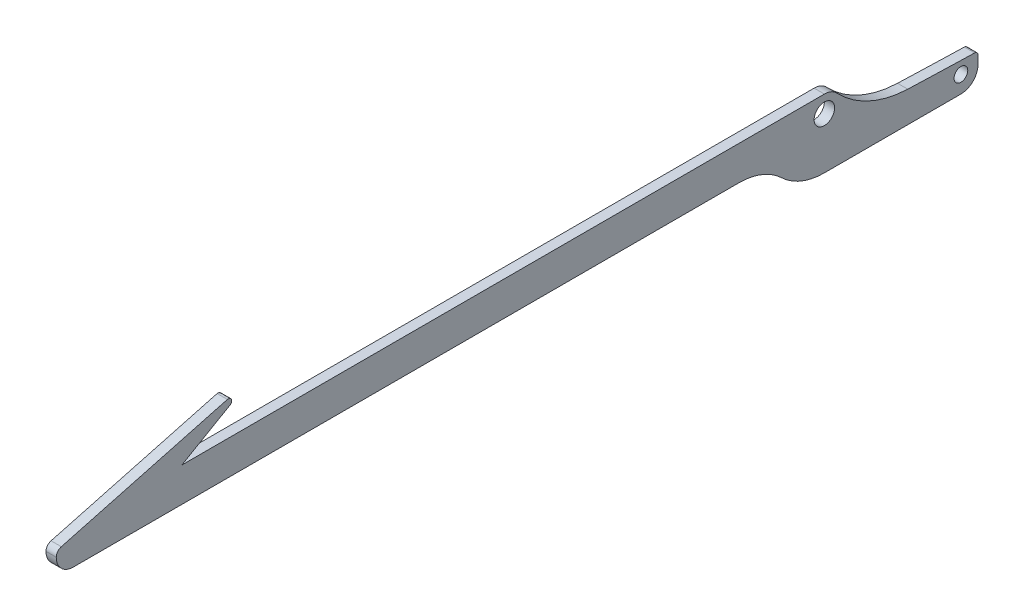
from build123d import *

# Parameters (mm, degrees)
EXTRUDE_1_DEPTH     = 1.5
EXTRUDE_2_DEPTH     = 3
CUT_EXTRUDE_1_DEPTH = 226.519400496
SKETCH_4_W          = 70
SKETCH_4_H          = 10
EXTRUDE_3_DEPTH     = 3
CUT_EXTRUDE_2_DEPTH = 226.519400496
FILLET_1_R          = 5
FILLET_START        = -1.5
FILLET_2_DEPTH      = 3
FILLET_3_R          = 1
CUT_EXTRUDE_3_DEPTH = 226.519400496
SKETCH_7_R          = 3
CUT_EXTRUDE_4_DEPTH = 226.519400496
SKETCH_8_R          = 2
CUT_EXTRUDE_5_DEPTH = 226.519400496


with BuildPart() as part:
    # ｽｹｯﾁ1 → ﾎﾞｽ - 押し出し1 (new, symmetric)
    with BuildSketch(Plane(origin=(0, 0, 0), x_dir=(0, 0, -1), z_dir=(1, 0, 0))):
        with BuildLine():
            Line((0, -5), (-220, -5))
            ThreePointArc((-220, -5), (-225, 0), (-220, 5))
            Line((-220, 5), (0, 5))
            ThreePointArc((0, 5), (5, 0), (0, -5))
        make_face()
    extrude(amount=EXTRUDE_1_DEPTH, both=True)

    # ｽｹｯﾁ2 → ﾎﾞｽ - 押し出し2 (add)
    with BuildSketch(Plane(origin=(1.5, 0, 0), x_dir=(0, 0, -1), z_dir=(1, 0, 0))):
        with BuildLine():
            Line((-223.51763809, 1.931851653), (-174.873811044, 14.965925826))
            ThreePointArc((-174.873811044, 14.965925826), (-173.691112467, 14.382683432), (-174.114991999, 13.133974596))
            Line((-174.114991999, 13.133974596), (-196.863703305, 0))
            Line((-196.863703305, 0), (-225, 0))
            ThreePointArc((-225, 0), (-224.586706681, 1.217522858), (-223.51763809, 1.931851653))
        make_face()
    extrude(amount=-EXTRUDE_2_DEPTH)

    # ｽｹｯﾁ3 → ｶｯﾄ - 押し出し1 (cut, through all)
    with BuildSketch(Plane(origin=(1.5, 0, 0), x_dir=(0, 0, -1), z_dir=(1, 0, 0))):
        with BuildLine():
            Line((-223.51763809, 1.931851653), (-212.067152572, 5))
            Line((-212.067152572, 5), (-220, 5))
            ThreePointArc((-220, 5), (-223.535533906, 3.535533906), (-225, 0))
            ThreePointArc((-225, 0), (-224.586706681, 1.217522858), (-223.51763809, 1.931851653))
        make_face()
    extrude(amount=-CUT_EXTRUDE_1_DEPTH, mode=Mode.SUBTRACT)

    # ｽｹｯﾁ4 → ﾎﾞｽ - 押し出し3 (add)
    with BuildSketch(Plane(origin=(1.5, 0, 0), x_dir=(0, 0, -1), z_dir=(1, 0, 0))):
        with Locations((10, -10)):
            Rectangle(SKETCH_4_W, SKETCH_4_H)
    extrude(amount=-EXTRUDE_3_DEPTH)

    # ｽｹｯﾁ5 → ｶｯﾄ - 押し出し2 (cut, through all)
    with BuildSketch(Plane(origin=(1.5, 0, 0), x_dir=(0, 0, -1), z_dir=(1, 0, 0))):
        with BuildLine():
            ThreePointArc((-0.222112537, -4.995064166), (22.385361516, -5.899367469), (45, -6.602057872))
            Line((45, -6.602057872), (45, -5))
            Line((45, -5), (0, -5))
            ThreePointArc((0, -5), (-0.111083686, -4.998765889), (-0.222112537, -4.995064166))
        make_face()
    extrude(amount=-CUT_EXTRUDE_2_DEPTH, mode=Mode.SUBTRACT)

    # ﾌｨﾚｯﾄ1
    fillet_1_edges = [part.edges().sort_by_distance(p)[0] for p in [
        (0, -15, -45),
    ]]
    fillet(fillet_1_edges, radius=FILLET_1_R)

    # ﾌｨﾚｯﾄ2: read off the stored shape, not the designer's step
    # ﾌｨﾚｯﾄ2 outline → ﾌｨﾚｯﾄ2 (add)
    with BuildSketch(Plane.YZ.offset(FILLET_START)):
        with BuildLine():
            ThreePointArc((-5.97098694, -24.423877243), (-3.3233227, -13.102392567), (3.430133723, -3.637881615))
            ThreePointArc((3.430133723, -3.637881615), (-2.082580259, -4.54564181), (-4.995064166, 0.222112537))
            ThreePointArc((-4.995064166, 0.222112537), (-5.512971584, -12.099696561), (-5.97098694, -24.423877243))
        make_face()
    extrude(amount=FILLET_2_DEPTH)

    # ﾌｨﾚｯﾄ3
    fillet_3_edges = [part.edges().sort_by_distance(p)[0] for p in [
        (0, -6.602057872, -45),
    ]]
    fillet(fillet_3_edges, radius=FILLET_3_R)

    # ｽｹｯﾁ6 → ｶｯﾄ - 押し出し3 (cut, through all)
    with BuildSketch(Plane(origin=(1.5, 0, 0), x_dir=(0, 0, -1), z_dir=(1, 0, 0))):
        with BuildLine():
            Line((0, -15), (-25, -15))
            Line((-25, -15), (-25, -5))
            ThreePointArc((-25, -5), (-18.268543991, -6.296359978), (-12.5, -10))
            ThreePointArc((-12.5, -10), (-6.731456009, -13.703640022), (0, -15))
        make_face()
    extrude(amount=-CUT_EXTRUDE_3_DEPTH, mode=Mode.SUBTRACT)

    # ｽｹｯﾁ7 → ｶｯﾄ - 押し出し4 (cut, through all)
    with BuildSketch(Plane(origin=(1.5, 0, 0), x_dir=(0, 0, -1), z_dir=(1, 0, 0))):
        Circle(SKETCH_7_R)
    extrude(amount=-CUT_EXTRUDE_4_DEPTH, mode=Mode.SUBTRACT)

    # ｽｹｯﾁ8 → ｶｯﾄ - 押し出し5 (cut, through all)
    with BuildSketch(Plane(origin=(1.5, 0, 0), x_dir=(0, 0, -1), z_dir=(1, 0, 0))):
        with Locations((40, -10)):
            Circle(SKETCH_8_R)
    extrude(amount=-CUT_EXTRUDE_5_DEPTH, mode=Mode.SUBTRACT)


solid = part.part
